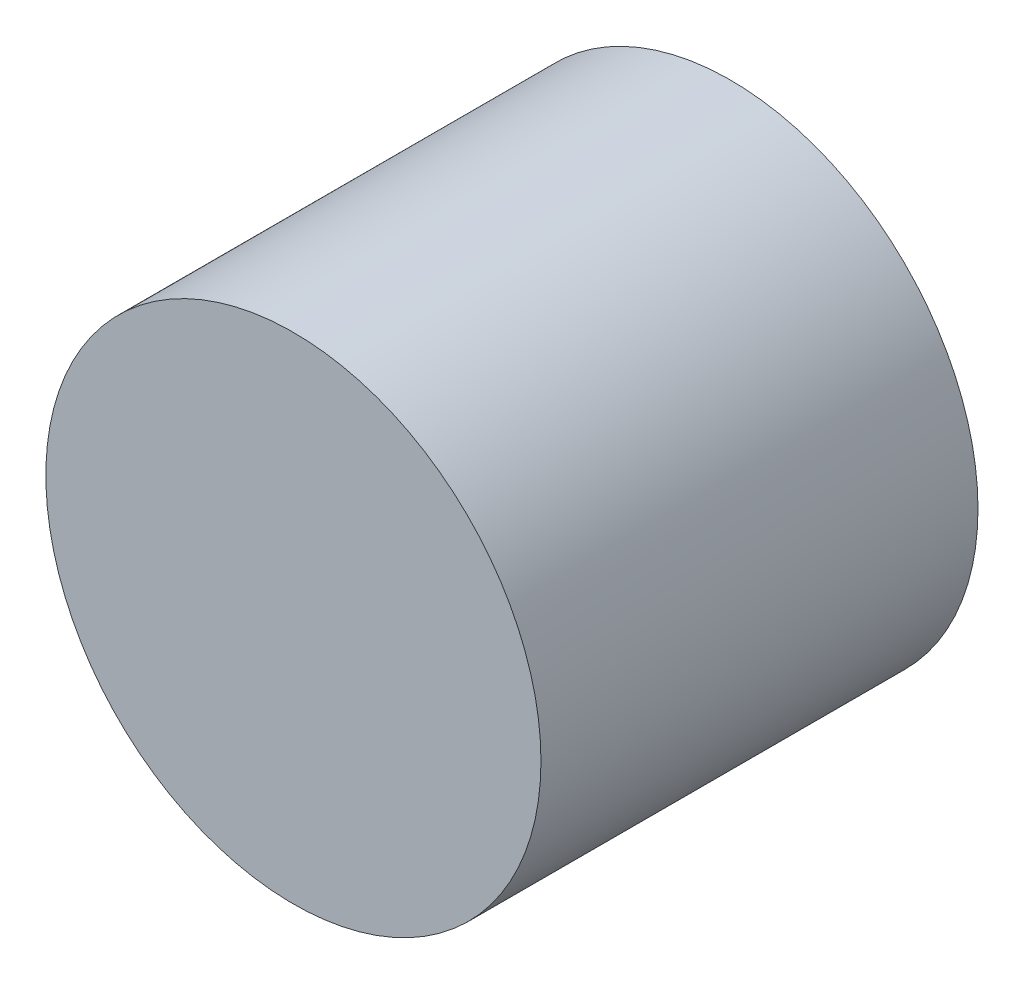
from build123d import *

# Parameters (mm, degrees)
SKETCH1_R           = 12.6619
BOSS_EXTRUDE1_DEPTH = 22.352


with BuildPart() as part:
    # Sketch1 → Boss-Extrude1 (new body)
    with BuildSketch(Plane(origin=(0, 0, 0), x_dir=(0, 1, 0), z_dir=(0, 0, 1))):
        Circle(SKETCH1_R)
    extrude(amount=BOSS_EXTRUDE1_DEPTH)


solid = part.part
